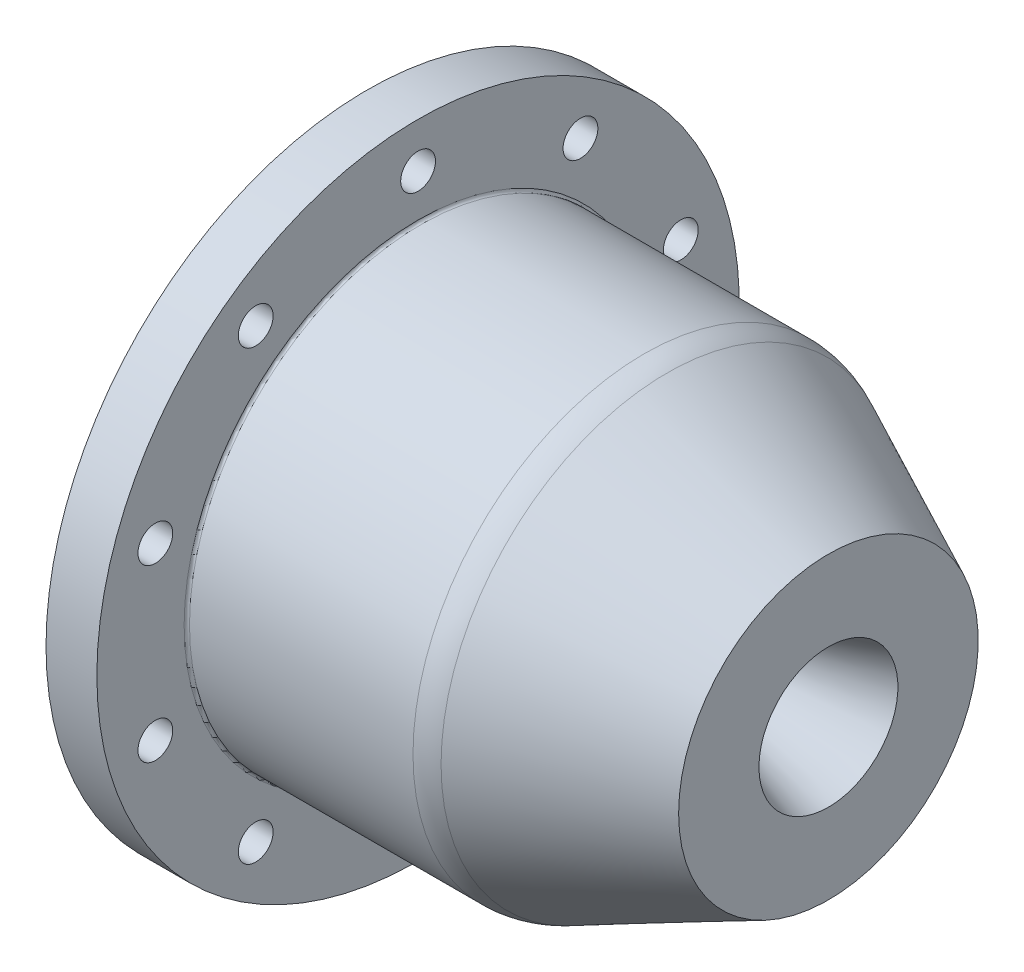
from build123d import *

# Parameters (mm, degrees)
HOLES_R            = 3.25
CUT_EXTRUDE2_DEPTH = 121.915154753
SKETCH9_R          = 1.8
PROBE_HOLE_DEPTH   = 57
FILLET1_R          = 10
FILLET2_R          = 0.5
FILLET3_R          = 1.2


with BuildPart() as part:
    # Cross_section → Revolve 2 (revolve)
    with BuildSketch(Plane.XY):
        with BuildLine():
            Line((21.032889293, 6.834), (39.942176945, 12.978))
            Line((39.942176945, 12.978), (39.942176945, 27.978))
            Line((39.942176945, 27.978), (7.796597981, 43.2))
            Line((7.796597981, 43.2), (-36.7, 43.2))
            Line((-36.7, 43.2), (-36.7, 60))
            Line((-36.7, 60), (-46.2, 60))
            Line((-46.2, 60), (-46.2, 31))
            Line((-46.2, 31), (-46.7, 31))
            Line((-46.7, 31), (-46.7, 25))
            Line((-46.7, 25), (0, 25))
            ThreePointArc((0, 25), (4.5, 23.794228634), (7.794228634, 20.5))
            Line((7.794228634, 20.5), (13.238660659, 11.334))
            ThreePointArc((13.238660659, 11.334), (16.532889293, 8.039771366), (21.032889293, 6.834))
        make_face()
    revolve(axis=Axis((0, 0, 0), (1, 0, 0)))

    # holes → Cut-Extrude2 (cut, through all)
    with BuildSketch(Plane.ZY.offset(46.2)):
        with Locations((0, 51.6)):
            Circle(HOLES_R)
        with Locations((30.329719018, 41.74527691)):
            Circle(HOLES_R)
        with Locations((49.074516241, 15.94527691)):
            Circle(HOLES_R)
        with Locations((49.074516241, -15.94527691)):
            Circle(HOLES_R)
        with Locations((30.329719018, -41.74527691)):
            Circle(HOLES_R)
        with Locations((0, -51.6)):
            Circle(HOLES_R)
        with Locations((-30.329719018, -41.74527691)):
            Circle(HOLES_R)
        with Locations((-49.074516241, -15.94527691)):
            Circle(HOLES_R)
        with Locations((-49.074516241, 15.94527691)):
            Circle(HOLES_R)
        with Locations((-30.329719018, 41.74527691)):
            Circle(HOLES_R)
    extrude(amount=-CUT_EXTRUDE2_DEPTH, mode=Mode.SUBTRACT)

    # Sketch9 → probe_hole (cut)
    with BuildSketch(Plane(origin=(0, 0, 0), x_dir=(1, 0, 0), z_dir=(0, -0.587785252292477, 0.8090169943749446))):
        with Locations((-23.35, 0)):
            Circle(SKETCH9_R)
    extrude(amount=-PROBE_HOLE_DEPTH, mode=Mode.SUBTRACT)

    # Fillet1
    fillet1_edges = [part.edges().sort_by_distance(p)[0] for p in [
        (7.796597981, -43.2, 0),
    ]]
    fillet(fillet1_edges, radius=FILLET1_R)

    # Fillet2
    fillet2_edges = [part.edges().sort_by_distance(p)[0] for p in [
        (-36.7, -43.2, 0),
    ]]
    fillet(fillet2_edges, radius=FILLET2_R)

    # Fillet3
    fillet3_edges = [part.edges().sort_by_distance(p)[0] for p in [
        (21.032889293, -6.834, 0),
    ]]
    fillet(fillet3_edges, radius=FILLET3_R)


solid = part.part
